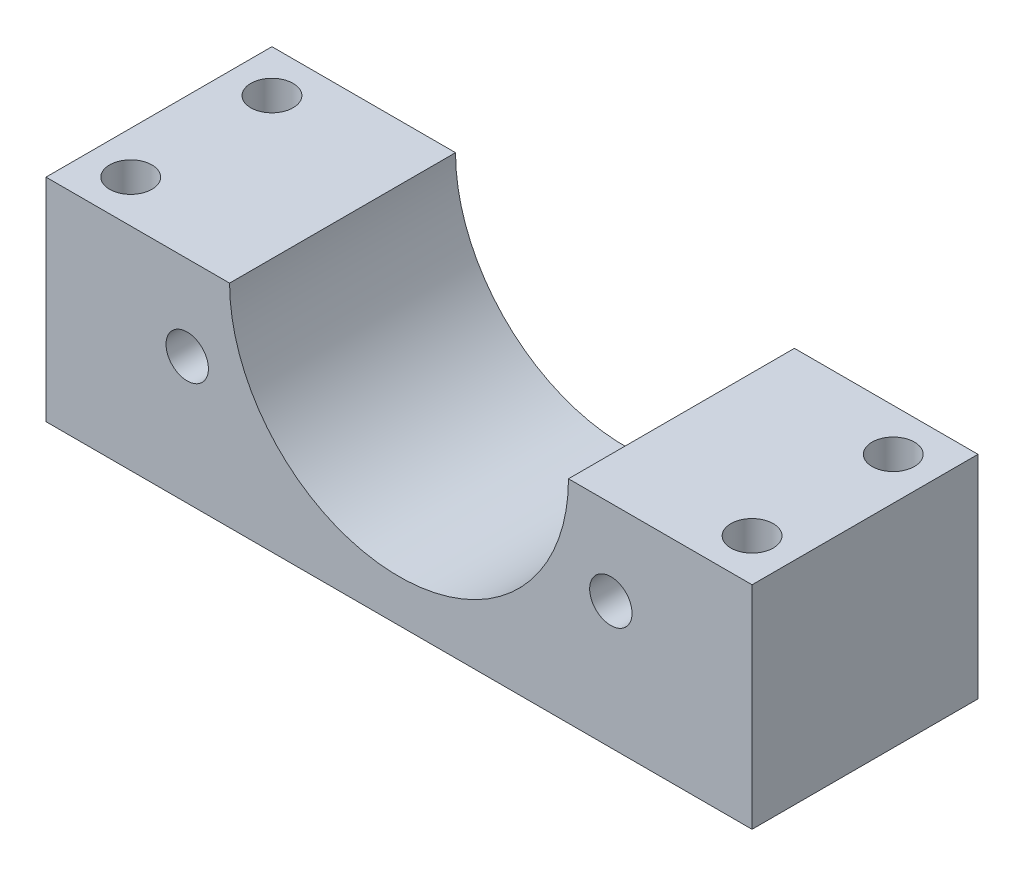
from build123d import *

# Parameters (mm, degrees)
SKETCH7_R            = 1.5
BOSS_EXTRUDE11_DEPTH = 16
F_3DSKETCH1_R        = 1.5
CUT_EXTRUDE6_DEPTH   = 16


with BuildPart() as part:
    # Sketch7 → Boss-Extrude11 (new body)
    with BuildSketch(Plane.XY):
        with BuildLine():
            Line((16.606233922, 2.029512174), (23.606233922, 2.029512174))
            Line((23.606233922, 2.029512174), (29.606233922, 2.029512174))
            Line((29.606233922, 2.029512174), (29.606233922, -9.970487826))
            Line((29.606233922, -9.970487826), (29.606233922, -12.970487826))
            Line((29.606233922, -12.970487826), (27.606233922, -12.970487826))
            Line((27.606233922, -12.970487826), (-14.393766078, -12.970487826))
            Line((-14.393766078, -12.970487826), (-20.393766078, -12.970487826))
            Line((-20.393766078, -12.970487826), (-20.393766078, -9.970487826))
            Line((-20.393766078, -9.970487826), (-20.393766078, 2.029512174))
            Line((-20.393766078, 2.029512174), (-14.393766078, 2.029512174))
            Line((-14.393766078, 2.029512174), (-7.393766078, 2.029512174))
            ThreePointArc((-7.393766078, 2.029512174), (4.606233922, -9.970487826), (16.606233922, 2.029512174))
        make_face()
        with Locations((-10.393766078, -3.970487826)):
            Circle(SKETCH7_R, mode=Mode.SUBTRACT)
        with Locations((19.606233922, -3.970487826)):
            Circle(SKETCH7_R, mode=Mode.SUBTRACT)
    extrude(amount=BOSS_EXTRUDE11_DEPTH)

    # 3DSketch1 → Cut-Extrude6 (cut)
    with BuildSketch(Plane(origin=(-17.393766078, 2.029512174, 3), x_dir=(0, 0, -1), z_dir=(0, -1, 0))):
        Circle(F_3DSKETCH1_R)
        with Locations((-10, 0)):
            Circle(F_3DSKETCH1_R)
        with Locations((0, 44)):
            Circle(F_3DSKETCH1_R)
        with Locations((-10, 44)):
            Circle(F_3DSKETCH1_R)
    extrude(amount=CUT_EXTRUDE6_DEPTH, mode=Mode.SUBTRACT)


solid = part.part
